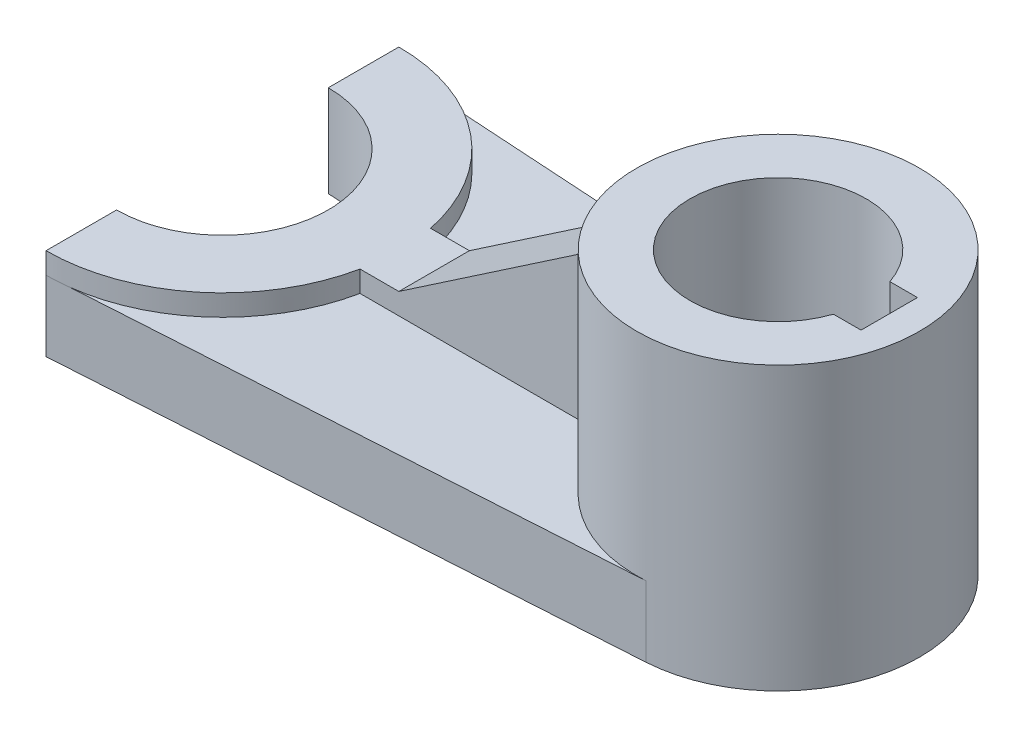
from build123d import *

# Parameters (mm, degrees)
EXTRUDE_6_DEPTH         = 10
CUT_EXTRUDE_START       = -10
CUT_EXTRUDE_3_DEPTH     = 10
EXTRUDE_3_DEPTH         = 3
SKETCH_20_R             = 20.039024427
EXTRUDE_7_DEPTH         = 30
RIB_START               = -5
RIB_1_DEPTH             = 10
HOLE_WIZARD_25_0_25_1_D = 25
SKETCH_24_W             = 14.5
SKETCH_24_H             = 8
CUT_EXTRUDE_4_DEPTH     = 93.870878105


# Read off the part's stored shape, not the designer's step: 切除-拉伸3, 筋1
with BuildPart() as part:
    # 草图17 → 凸台-拉伸6 (new body)
    with BuildSketch(Plane(origin=(0, 0, 0), x_dir=(1, 0, 0), z_dir=(0, 1, 0))):
        with BuildLine():
            Line((-80, 25), (-80, -25))
            Line((-80, -25), (0, -20))
            ThreePointArc((0, -20), (18.789024427, 0), (0, 20))
            Line((0, 20), (-80, 25))
        make_face()
    extrude(amount=EXTRUDE_6_DEPTH)

    # 切除-拉伸3 outline → 切除-拉伸3 (cut)
    with BuildSketch(Plane(origin=(0, 10, 0), x_dir=(1, 0, 0), z_dir=(0, 1, 0)).offset(CUT_EXTRUDE_START)):
        with BuildLine():
            ThreePointArc((-80, -15), (-65, 0), (-80, 15))
            Line((-80, 15), (-80, -15))
        make_face()
    extrude(amount=CUT_EXTRUDE_3_DEPTH, mode=Mode.SUBTRACT)

    # 草图19 → 拉伸-薄壁3 (add)
    with BuildSketch(Plane(origin=(0, 10, 0), x_dir=(1, 0, 0), z_dir=(0, 1, 0))):
        with BuildLine():
            ThreePointArc((-80, 25), (-55, 0), (-80, -25))
            Line((-80, -25), (-80, -15))
            ThreePointArc((-80, -15), (-65, 0), (-80, 15))
            Line((-80, 15), (-80, 25))
        make_face()
    extrude(amount=EXTRUDE_3_DEPTH)

    # 草图20 → 凸台-拉伸7 (add)
    with BuildSketch(Plane(origin=(0, 10, 0), x_dir=(1, 0, 0), z_dir=(0, 1, 0))):
        with Locations(Location((-1.25, 0, 0), (0, 0, 86.423665625))):
            Circle(SKETCH_20_R)
    extrude(amount=EXTRUDE_7_DEPTH)

    # 筋1 outline → 筋1 (add)
    with BuildSketch(Plane.XY.offset(RIB_START)):
        Polygon((-20.65521837, 32.930470155), (-50, 13), (-57, 13), (-57, 10), (-19, 10), (-19, 34), (-19.080487844, 34), align=None)
    extrude(amount=RIB_1_DEPTH)

    # Ø25.0 (25) 直径孔1 (through all)
    with Locations(Plane(origin=(0, 40, 0), x_dir=(1, 0, 0), z_dir=(0, 1, 0))):
        with Locations((-1.25, 0)):
            Hole(HOLE_WIZARD_25_0_25_1_D / 2)

    # 草图24 → 切除-拉伸4 (cut, through all)
    with BuildSketch(Plane(origin=(0, 40, 0), x_dir=(1, 0, 0), z_dir=(0, 1, 0))):
        with Locations((7.25, 0)):
            Rectangle(SKETCH_24_W, SKETCH_24_H)
    extrude(amount=-CUT_EXTRUDE_4_DEPTH, mode=Mode.SUBTRACT)


solid = part.part
